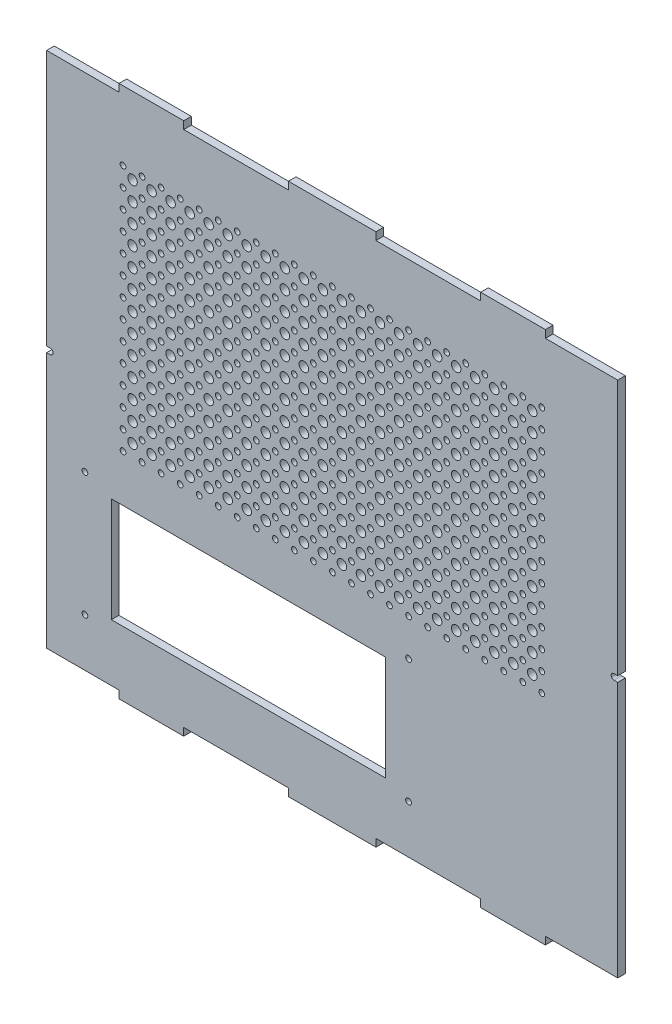
from build123d import *

# Parameters (mm, degrees)
SKETCH1_R           = 1.5
SKETCH1_W           = 144
SKETCH1_H           = 55
SKETCH1_R_2         = 2.5
BOSS_EXTRUDE1_DEPTH = 4


with BuildPart() as part:
    # Sketch1 → Boss-Extrude1 (new body)
    with BuildSketch(Plane.XY):
        with BuildLine():
            Line((-78, 140), (-112, 140))
            Line((-112, 140), (-112, 136))
            Line((-112, 136), (-150, 136))
            Line((-150, 136), (-150, 1.5))
            Line((-150, 1.5), (-148.049455327, 1.5))
            ThreePointArc((-148.049455327, 1.5), (-146.549455327, 0), (-148.049455327, -1.5))
            Line((-148.049455327, -1.5), (-150, -1.5))
            Line((-150, -1.5), (-150, -136))
            Line((-150, -136), (-112, -136))
            Line((-112, -136), (-112, -140))
            Line((-112, -140), (-78, -140))
            Line((-78, -140), (-78, -136))
            Line((-78, -136), (-23, -136))
            Line((-23, -136), (-23, -140))
            Line((-23, -140), (23, -140))
            Line((23, -140), (23, -136))
            Line((23, -136), (78, -136))
            Line((78, -136), (78, -140))
            Line((78, -140), (112, -140))
            Line((112, -140), (112, -136))
            Line((112, -136), (150, -136))
            Line((150, -136), (150, -1.5))
            Line((150, -1.5), (148.049455327, -1.5))
            ThreePointArc((148.049455327, -1.5), (146.549455327, 0), (148.049455327, 1.5))
            Line((148.049455327, 1.5), (150, 1.5))
            Line((150, 1.5), (150, 136))
            Line((150, 136), (112, 136))
            Line((112, 136), (112, 140))
            Line((112, 140), (78, 140))
            Line((78, 140), (78, 136))
            Line((78, 136), (23, 136))
            Line((23, 136), (23, 140))
            Line((23, 140), (-23, 140))
            Line((-23, 140), (-23, 136))
            Line((-23, 136), (-78, 136))
            Line((-78, 136), (-78, 140))
        make_face()
        with Locations((110.112263803, 103.682279134)):
            Circle(SKETCH1_R, mode=Mode.SUBTRACT)
        with Locations((-129.889105123, -110.626211869)):
            Circle(SKETCH1_R, mode=Mode.SUBTRACT)
        with Locations((-44, -78.5)):
            Rectangle(SKETCH1_W, SKETCH1_H, mode=Mode.SUBTRACT)
        with Locations((-129.889105123, -45.69513346)):
            Circle(SKETCH1_R, mode=Mode.SUBTRACT)
        with Locations((-109.887736197, -26.317720866)):
            Circle(SKETCH1_R, mode=Mode.SUBTRACT)
        with Locations((-99.887736197, -26.317720866)):
            Circle(SKETCH1_R, mode=Mode.SUBTRACT)
        with Locations((-104.887736197, -20.317720866)):
            Circle(SKETCH1_R_2, mode=Mode.SUBTRACT)
        with Locations((-94.887736197, -20.317720866)):
            Circle(SKETCH1_R_2, mode=Mode.SUBTRACT)
        with Locations((-89.887736197, -26.317720866)):
            Circle(SKETCH1_R, mode=Mode.SUBTRACT)
        with Locations((-79.887736197, -26.317720866)):
            Circle(SKETCH1_R, mode=Mode.SUBTRACT)
        with Locations((-84.887736197, -20.317720866)):
            Circle(SKETCH1_R_2, mode=Mode.SUBTRACT)
        with Locations((-109.887736197, -16.317720866)):
            Circle(SKETCH1_R, mode=Mode.SUBTRACT)
        with Locations((-104.887736197, -10.317720866)):
            Circle(SKETCH1_R_2, mode=Mode.SUBTRACT)
        with Locations((-99.887736197, -16.317720866)):
            Circle(SKETCH1_R, mode=Mode.SUBTRACT)
        with Locations((-94.887736197, -10.317720866)):
            Circle(SKETCH1_R_2, mode=Mode.SUBTRACT)
        with Locations((-109.887736197, -6.317720866)):
            Circle(SKETCH1_R, mode=Mode.SUBTRACT)
        with Locations((-104.887736197, -0.317720866)):
            Circle(SKETCH1_R_2, mode=Mode.SUBTRACT)
        with Locations((-99.887736197, -6.317720866)):
            Circle(SKETCH1_R, mode=Mode.SUBTRACT)
        with Locations((-94.887736197, -0.317720866)):
            Circle(SKETCH1_R_2, mode=Mode.SUBTRACT)
        with Locations((-89.887736197, -16.317720866)):
            Circle(SKETCH1_R, mode=Mode.SUBTRACT)
        with Locations((-84.887736197, -10.317720866)):
            Circle(SKETCH1_R_2, mode=Mode.SUBTRACT)
        with Locations((-79.887736197, -16.317720866)):
            Circle(SKETCH1_R, mode=Mode.SUBTRACT)
        with Locations((-89.887736197, -6.317720866)):
            Circle(SKETCH1_R, mode=Mode.SUBTRACT)
        with Locations((-84.887736197, -0.317720866)):
            Circle(SKETCH1_R_2, mode=Mode.SUBTRACT)
        with Locations((-79.887736197, -6.317720866)):
            Circle(SKETCH1_R, mode=Mode.SUBTRACT)
        with Locations((-69.887736197, -26.317720866)):
            Circle(SKETCH1_R, mode=Mode.SUBTRACT)
        with Locations((-59.887736197, -26.317720866)):
            Circle(SKETCH1_R, mode=Mode.SUBTRACT)
        with Locations((-74.887736197, -20.317720866)):
            Circle(SKETCH1_R_2, mode=Mode.SUBTRACT)
        with Locations((-64.887736197, -20.317720866)):
            Circle(SKETCH1_R_2, mode=Mode.SUBTRACT)
        with Locations((-49.887736197, -26.317720866)):
            Circle(SKETCH1_R, mode=Mode.SUBTRACT)
        with Locations((-39.887736197, -26.317720866)):
            Circle(SKETCH1_R, mode=Mode.SUBTRACT)
        with Locations((-54.887736197, -20.317720866)):
            Circle(SKETCH1_R_2, mode=Mode.SUBTRACT)
        with Locations((-44.887736197, -20.317720866)):
            Circle(SKETCH1_R_2, mode=Mode.SUBTRACT)
        with Locations((-69.887736197, -16.317720866)):
            Circle(SKETCH1_R, mode=Mode.SUBTRACT)
        with Locations((-74.887736197, -10.317720866)):
            Circle(SKETCH1_R_2, mode=Mode.SUBTRACT)
        with Locations((-59.887736197, -16.317720866)):
            Circle(SKETCH1_R, mode=Mode.SUBTRACT)
        with Locations((-64.887736197, -10.317720866)):
            Circle(SKETCH1_R_2, mode=Mode.SUBTRACT)
        with Locations((-69.887736197, -6.317720866)):
            Circle(SKETCH1_R, mode=Mode.SUBTRACT)
        with Locations((-74.887736197, -0.317720866)):
            Circle(SKETCH1_R_2, mode=Mode.SUBTRACT)
        with Locations((-59.887736197, -6.317720866)):
            Circle(SKETCH1_R, mode=Mode.SUBTRACT)
        with Locations((-64.887736197, -0.317720866)):
            Circle(SKETCH1_R_2, mode=Mode.SUBTRACT)
        with Locations((-49.887736197, -16.317720866)):
            Circle(SKETCH1_R, mode=Mode.SUBTRACT)
        with Locations((-54.887736197, -10.317720866)):
            Circle(SKETCH1_R_2, mode=Mode.SUBTRACT)
        with Locations((-39.887736197, -16.317720866)):
            Circle(SKETCH1_R, mode=Mode.SUBTRACT)
        with Locations((-44.887736197, -10.317720866)):
            Circle(SKETCH1_R_2, mode=Mode.SUBTRACT)
        with Locations((-49.887736197, -6.317720866)):
            Circle(SKETCH1_R, mode=Mode.SUBTRACT)
        with Locations((-54.887736197, -0.317720866)):
            Circle(SKETCH1_R_2, mode=Mode.SUBTRACT)
        with Locations((-39.887736197, -6.317720866)):
            Circle(SKETCH1_R, mode=Mode.SUBTRACT)
        with Locations((-44.887736197, -0.317720866)):
            Circle(SKETCH1_R_2, mode=Mode.SUBTRACT)
        with Locations((-29.887736197, -26.317720866)):
            Circle(SKETCH1_R, mode=Mode.SUBTRACT)
        with Locations((-19.887736197, -26.317720866)):
            Circle(SKETCH1_R, mode=Mode.SUBTRACT)
        with Locations((-34.887736197, -20.317720866)):
            Circle(SKETCH1_R_2, mode=Mode.SUBTRACT)
        with Locations((-24.887736197, -20.317720866)):
            Circle(SKETCH1_R_2, mode=Mode.SUBTRACT)
        with Locations((-9.887736197, -26.317720866)):
            Circle(SKETCH1_R, mode=Mode.SUBTRACT)
        with Locations((-14.887736197, -20.317720866)):
            Circle(SKETCH1_R_2, mode=Mode.SUBTRACT)
        with Locations((-4.887736197, -20.317720866)):
            Circle(SKETCH1_R_2, mode=Mode.SUBTRACT)
        with Locations((-29.887736197, -16.317720866)):
            Circle(SKETCH1_R, mode=Mode.SUBTRACT)
        with Locations((-34.887736197, -10.317720866)):
            Circle(SKETCH1_R_2, mode=Mode.SUBTRACT)
        with Locations((-19.887736197, -16.317720866)):
            Circle(SKETCH1_R, mode=Mode.SUBTRACT)
        with Locations((-24.887736197, -10.317720866)):
            Circle(SKETCH1_R_2, mode=Mode.SUBTRACT)
        with Locations((-29.887736197, -6.317720866)):
            Circle(SKETCH1_R, mode=Mode.SUBTRACT)
        with Locations((-34.887736197, -0.317720866)):
            Circle(SKETCH1_R_2, mode=Mode.SUBTRACT)
        with Locations((-19.887736197, -6.317720866)):
            Circle(SKETCH1_R, mode=Mode.SUBTRACT)
        with Locations((-24.887736197, -0.317720866)):
            Circle(SKETCH1_R_2, mode=Mode.SUBTRACT)
        with Locations((-9.887736197, -16.317720866)):
            Circle(SKETCH1_R, mode=Mode.SUBTRACT)
        with Locations((-14.887736197, -10.317720866)):
            Circle(SKETCH1_R_2, mode=Mode.SUBTRACT)
        with Locations((-4.887736197, -10.317720866)):
            Circle(SKETCH1_R_2, mode=Mode.SUBTRACT)
        with Locations((-9.887736197, -6.317720866)):
            Circle(SKETCH1_R, mode=Mode.SUBTRACT)
        with Locations((-14.887736197, -0.317720866)):
            Circle(SKETCH1_R_2, mode=Mode.SUBTRACT)
        with Locations((-4.887736197, -0.317720866)):
            Circle(SKETCH1_R_2, mode=Mode.SUBTRACT)
        with Locations((40.112263803, -110.626211869)):
            Circle(SKETCH1_R, mode=Mode.SUBTRACT)
        with Locations((40.112263803, -45.69513346)):
            Circle(SKETCH1_R, mode=Mode.SUBTRACT)
        with Locations((0.112263803, -26.317720866)):
            Circle(SKETCH1_R, mode=Mode.SUBTRACT)
        with Locations((10.112263803, -26.317720866)):
            Circle(SKETCH1_R, mode=Mode.SUBTRACT)
        with Locations((5.112263803, -20.317720866)):
            Circle(SKETCH1_R_2, mode=Mode.SUBTRACT)
        with Locations((15.112263803, -20.317720866)):
            Circle(SKETCH1_R_2, mode=Mode.SUBTRACT)
        with Locations((20.112263803, -26.317720866)):
            Circle(SKETCH1_R, mode=Mode.SUBTRACT)
        with Locations((30.112263803, -26.317720866)):
            Circle(SKETCH1_R, mode=Mode.SUBTRACT)
        with Locations((25.112263803, -20.317720866)):
            Circle(SKETCH1_R_2, mode=Mode.SUBTRACT)
        with Locations((35.112263803, -20.317720866)):
            Circle(SKETCH1_R_2, mode=Mode.SUBTRACT)
        with Locations((0.112263803, -16.317720866)):
            Circle(SKETCH1_R, mode=Mode.SUBTRACT)
        with Locations((5.112263803, -10.317720866)):
            Circle(SKETCH1_R_2, mode=Mode.SUBTRACT)
        with Locations((10.112263803, -16.317720866)):
            Circle(SKETCH1_R, mode=Mode.SUBTRACT)
        with Locations((15.112263803, -10.317720866)):
            Circle(SKETCH1_R_2, mode=Mode.SUBTRACT)
        with Locations((0.112263803, -6.317720866)):
            Circle(SKETCH1_R, mode=Mode.SUBTRACT)
        with Locations((5.112263803, -0.317720866)):
            Circle(SKETCH1_R_2, mode=Mode.SUBTRACT)
        with Locations((10.112263803, -6.317720866)):
            Circle(SKETCH1_R, mode=Mode.SUBTRACT)
        with Locations((15.112263803, -0.317720866)):
            Circle(SKETCH1_R_2, mode=Mode.SUBTRACT)
        with Locations((20.112263803, -16.317720866)):
            Circle(SKETCH1_R, mode=Mode.SUBTRACT)
        with Locations((25.112263803, -10.317720866)):
            Circle(SKETCH1_R_2, mode=Mode.SUBTRACT)
        with Locations((30.112263803, -16.317720866)):
            Circle(SKETCH1_R, mode=Mode.SUBTRACT)
        with Locations((35.112263803, -10.317720866)):
            Circle(SKETCH1_R_2, mode=Mode.SUBTRACT)
        with Locations((20.112263803, -6.317720866)):
            Circle(SKETCH1_R, mode=Mode.SUBTRACT)
        with Locations((25.112263803, -0.317720866)):
            Circle(SKETCH1_R_2, mode=Mode.SUBTRACT)
        with Locations((30.112263803, -6.317720866)):
            Circle(SKETCH1_R, mode=Mode.SUBTRACT)
        with Locations((35.112263803, -0.317720866)):
            Circle(SKETCH1_R_2, mode=Mode.SUBTRACT)
        with Locations((40.112263803, -26.317720866)):
            Circle(SKETCH1_R, mode=Mode.SUBTRACT)
        with Locations((50.112263803, -26.317720866)):
            Circle(SKETCH1_R, mode=Mode.SUBTRACT)
        with Locations((45.112263803, -20.317720866)):
            Circle(SKETCH1_R_2, mode=Mode.SUBTRACT)
        with Locations((55.112263803, -20.317720866)):
            Circle(SKETCH1_R_2, mode=Mode.SUBTRACT)
        with Locations((60.112263803, -26.317720866)):
            Circle(SKETCH1_R, mode=Mode.SUBTRACT)
        with Locations((70.112263803, -26.317720866)):
            Circle(SKETCH1_R, mode=Mode.SUBTRACT)
        with Locations((65.112263803, -20.317720866)):
            Circle(SKETCH1_R_2, mode=Mode.SUBTRACT)
        with Locations((40.112263803, -16.317720866)):
            Circle(SKETCH1_R, mode=Mode.SUBTRACT)
        with Locations((45.112263803, -10.317720866)):
            Circle(SKETCH1_R_2, mode=Mode.SUBTRACT)
        with Locations((50.112263803, -16.317720866)):
            Circle(SKETCH1_R, mode=Mode.SUBTRACT)
        with Locations((55.112263803, -10.317720866)):
            Circle(SKETCH1_R_2, mode=Mode.SUBTRACT)
        with Locations((40.112263803, -6.317720866)):
            Circle(SKETCH1_R, mode=Mode.SUBTRACT)
        with Locations((45.112263803, -0.317720866)):
            Circle(SKETCH1_R_2, mode=Mode.SUBTRACT)
        with Locations((50.112263803, -6.317720866)):
            Circle(SKETCH1_R, mode=Mode.SUBTRACT)
        with Locations((55.112263803, -0.317720866)):
            Circle(SKETCH1_R_2, mode=Mode.SUBTRACT)
        with Locations((60.112263803, -16.317720866)):
            Circle(SKETCH1_R, mode=Mode.SUBTRACT)
        with Locations((65.112263803, -10.317720866)):
            Circle(SKETCH1_R_2, mode=Mode.SUBTRACT)
        with Locations((70.112263803, -16.317720866)):
            Circle(SKETCH1_R, mode=Mode.SUBTRACT)
        with Locations((60.112263803, -6.317720866)):
            Circle(SKETCH1_R, mode=Mode.SUBTRACT)
        with Locations((65.112263803, -0.317720866)):
            Circle(SKETCH1_R_2, mode=Mode.SUBTRACT)
        with Locations((70.112263803, -6.317720866)):
            Circle(SKETCH1_R, mode=Mode.SUBTRACT)
        with Locations((80.112263803, -26.317720866)):
            Circle(SKETCH1_R, mode=Mode.SUBTRACT)
        with Locations((90.112263803, -26.317720866)):
            Circle(SKETCH1_R, mode=Mode.SUBTRACT)
        with Locations((75.112263803, -20.317720866)):
            Circle(SKETCH1_R_2, mode=Mode.SUBTRACT)
        with Locations((85.112263803, -20.317720866)):
            Circle(SKETCH1_R_2, mode=Mode.SUBTRACT)
        with Locations((100.112263803, -26.317720866)):
            Circle(SKETCH1_R, mode=Mode.SUBTRACT)
        with Locations((110.112263803, -26.317720866)):
            Circle(SKETCH1_R, mode=Mode.SUBTRACT)
        with Locations((95.112263803, -20.317720866)):
            Circle(SKETCH1_R_2, mode=Mode.SUBTRACT)
        with Locations((105.112263803, -20.317720866)):
            Circle(SKETCH1_R_2, mode=Mode.SUBTRACT)
        with Locations((80.112263803, -16.317720866)):
            Circle(SKETCH1_R, mode=Mode.SUBTRACT)
        with Locations((75.112263803, -10.317720866)):
            Circle(SKETCH1_R_2, mode=Mode.SUBTRACT)
        with Locations((90.112263803, -16.317720866)):
            Circle(SKETCH1_R, mode=Mode.SUBTRACT)
        with Locations((85.112263803, -10.317720866)):
            Circle(SKETCH1_R_2, mode=Mode.SUBTRACT)
        with Locations((80.112263803, -6.317720866)):
            Circle(SKETCH1_R, mode=Mode.SUBTRACT)
        with Locations((75.112263803, -0.317720866)):
            Circle(SKETCH1_R_2, mode=Mode.SUBTRACT)
        with Locations((90.112263803, -6.317720866)):
            Circle(SKETCH1_R, mode=Mode.SUBTRACT)
        with Locations((85.112263803, -0.317720866)):
            Circle(SKETCH1_R_2, mode=Mode.SUBTRACT)
        with Locations((100.112263803, -16.317720866)):
            Circle(SKETCH1_R, mode=Mode.SUBTRACT)
        with Locations((95.112263803, -10.317720866)):
            Circle(SKETCH1_R_2, mode=Mode.SUBTRACT)
        with Locations((110.112263803, -16.317720866)):
            Circle(SKETCH1_R, mode=Mode.SUBTRACT)
        with Locations((105.112263803, -10.317720866)):
            Circle(SKETCH1_R_2, mode=Mode.SUBTRACT)
        with Locations((100.112263803, -6.317720866)):
            Circle(SKETCH1_R, mode=Mode.SUBTRACT)
        with Locations((95.112263803, -0.317720866)):
            Circle(SKETCH1_R_2, mode=Mode.SUBTRACT)
        with Locations((110.112263803, -6.317720866)):
            Circle(SKETCH1_R, mode=Mode.SUBTRACT)
        with Locations((105.112263803, -0.317720866)):
            Circle(SKETCH1_R_2, mode=Mode.SUBTRACT)
        with Locations((-109.887736197, 3.682279134)):
            Circle(SKETCH1_R, mode=Mode.SUBTRACT)
        with Locations((-99.887736197, 3.682279134)):
            Circle(SKETCH1_R, mode=Mode.SUBTRACT)
        with Locations((-104.887736197, 9.682279134)):
            Circle(SKETCH1_R_2, mode=Mode.SUBTRACT)
        with Locations((-109.887736197, 13.682279134)):
            Circle(SKETCH1_R, mode=Mode.SUBTRACT)
        with Locations((-94.887736197, 9.682279134)):
            Circle(SKETCH1_R_2, mode=Mode.SUBTRACT)
        with Locations((-99.887736197, 13.682279134)):
            Circle(SKETCH1_R, mode=Mode.SUBTRACT)
        with Locations((-89.887736197, 3.682279134)):
            Circle(SKETCH1_R, mode=Mode.SUBTRACT)
        with Locations((-79.887736197, 3.682279134)):
            Circle(SKETCH1_R, mode=Mode.SUBTRACT)
        with Locations((-84.887736197, 9.682279134)):
            Circle(SKETCH1_R_2, mode=Mode.SUBTRACT)
        with Locations((-89.887736197, 13.682279134)):
            Circle(SKETCH1_R, mode=Mode.SUBTRACT)
        with Locations((-79.887736197, 13.682279134)):
            Circle(SKETCH1_R, mode=Mode.SUBTRACT)
        with Locations((-104.887736197, 19.682279134)):
            Circle(SKETCH1_R_2, mode=Mode.SUBTRACT)
        with Locations((-109.887736197, 23.682279134)):
            Circle(SKETCH1_R, mode=Mode.SUBTRACT)
        with Locations((-94.887736197, 19.682279134)):
            Circle(SKETCH1_R_2, mode=Mode.SUBTRACT)
        with Locations((-99.887736197, 23.682279134)):
            Circle(SKETCH1_R, mode=Mode.SUBTRACT)
        with Locations((-104.887736197, 29.682279134)):
            Circle(SKETCH1_R_2, mode=Mode.SUBTRACT)
        with Locations((-109.887736197, 33.682279134)):
            Circle(SKETCH1_R, mode=Mode.SUBTRACT)
        with Locations((-94.887736197, 29.682279134)):
            Circle(SKETCH1_R_2, mode=Mode.SUBTRACT)
        with Locations((-99.887736197, 33.682279134)):
            Circle(SKETCH1_R, mode=Mode.SUBTRACT)
        with Locations((-84.887736197, 19.682279134)):
            Circle(SKETCH1_R_2, mode=Mode.SUBTRACT)
        with Locations((-89.887736197, 23.682279134)):
            Circle(SKETCH1_R, mode=Mode.SUBTRACT)
        with Locations((-79.887736197, 23.682279134)):
            Circle(SKETCH1_R, mode=Mode.SUBTRACT)
        with Locations((-84.887736197, 29.682279134)):
            Circle(SKETCH1_R_2, mode=Mode.SUBTRACT)
        with Locations((-89.887736197, 33.682279134)):
            Circle(SKETCH1_R, mode=Mode.SUBTRACT)
        with Locations((-79.887736197, 33.682279134)):
            Circle(SKETCH1_R, mode=Mode.SUBTRACT)
        with Locations((-109.887736197, 43.682279134)):
            Circle(SKETCH1_R, mode=Mode.SUBTRACT)
        with Locations((-104.887736197, 39.682279134)):
            Circle(SKETCH1_R_2, mode=Mode.SUBTRACT)
        with Locations((-99.887736197, 43.682279134)):
            Circle(SKETCH1_R, mode=Mode.SUBTRACT)
        with Locations((-94.887736197, 39.682279134)):
            Circle(SKETCH1_R_2, mode=Mode.SUBTRACT)
        with Locations((-104.887736197, 49.682279134)):
            Circle(SKETCH1_R_2, mode=Mode.SUBTRACT)
        with Locations((-94.887736197, 49.682279134)):
            Circle(SKETCH1_R_2, mode=Mode.SUBTRACT)
        with Locations((-89.887736197, 43.682279134)):
            Circle(SKETCH1_R, mode=Mode.SUBTRACT)
        with Locations((-84.887736197, 39.682279134)):
            Circle(SKETCH1_R_2, mode=Mode.SUBTRACT)
        with Locations((-79.887736197, 43.682279134)):
            Circle(SKETCH1_R, mode=Mode.SUBTRACT)
        with Locations((-84.887736197, 49.682279134)):
            Circle(SKETCH1_R_2, mode=Mode.SUBTRACT)
        with Locations((-109.887736197, 53.682279134)):
            Circle(SKETCH1_R, mode=Mode.SUBTRACT)
        with Locations((-104.887736197, 59.682279134)):
            Circle(SKETCH1_R_2, mode=Mode.SUBTRACT)
        with Locations((-99.887736197, 53.682279134)):
            Circle(SKETCH1_R, mode=Mode.SUBTRACT)
        with Locations((-94.887736197, 59.682279134)):
            Circle(SKETCH1_R_2, mode=Mode.SUBTRACT)
        with Locations((-109.887736197, 63.682279134)):
            Circle(SKETCH1_R, mode=Mode.SUBTRACT)
        with Locations((-104.887736197, 69.682279134)):
            Circle(SKETCH1_R_2, mode=Mode.SUBTRACT)
        with Locations((-99.887736197, 63.682279134)):
            Circle(SKETCH1_R, mode=Mode.SUBTRACT)
        with Locations((-94.887736197, 69.682279134)):
            Circle(SKETCH1_R_2, mode=Mode.SUBTRACT)
        with Locations((-89.887736197, 53.682279134)):
            Circle(SKETCH1_R, mode=Mode.SUBTRACT)
        with Locations((-84.887736197, 59.682279134)):
            Circle(SKETCH1_R_2, mode=Mode.SUBTRACT)
        with Locations((-79.887736197, 53.682279134)):
            Circle(SKETCH1_R, mode=Mode.SUBTRACT)
        with Locations((-89.887736197, 63.682279134)):
            Circle(SKETCH1_R, mode=Mode.SUBTRACT)
        with Locations((-84.887736197, 69.682279134)):
            Circle(SKETCH1_R_2, mode=Mode.SUBTRACT)
        with Locations((-79.887736197, 63.682279134)):
            Circle(SKETCH1_R, mode=Mode.SUBTRACT)
        with Locations((-69.887736197, 3.682279134)):
            Circle(SKETCH1_R, mode=Mode.SUBTRACT)
        with Locations((-59.887736197, 3.682279134)):
            Circle(SKETCH1_R, mode=Mode.SUBTRACT)
        with Locations((-74.887736197, 9.682279134)):
            Circle(SKETCH1_R_2, mode=Mode.SUBTRACT)
        with Locations((-69.887736197, 13.682279134)):
            Circle(SKETCH1_R, mode=Mode.SUBTRACT)
        with Locations((-64.887736197, 9.682279134)):
            Circle(SKETCH1_R_2, mode=Mode.SUBTRACT)
        with Locations((-59.887736197, 13.682279134)):
            Circle(SKETCH1_R, mode=Mode.SUBTRACT)
        with Locations((-49.887736197, 3.682279134)):
            Circle(SKETCH1_R, mode=Mode.SUBTRACT)
        with Locations((-39.887736197, 3.682279134)):
            Circle(SKETCH1_R, mode=Mode.SUBTRACT)
        with Locations((-54.887736197, 9.682279134)):
            Circle(SKETCH1_R_2, mode=Mode.SUBTRACT)
        with Locations((-49.887736197, 13.682279134)):
            Circle(SKETCH1_R, mode=Mode.SUBTRACT)
        with Locations((-44.887736197, 9.682279134)):
            Circle(SKETCH1_R_2, mode=Mode.SUBTRACT)
        with Locations((-39.887736197, 13.682279134)):
            Circle(SKETCH1_R, mode=Mode.SUBTRACT)
        with Locations((-74.887736197, 19.682279134)):
            Circle(SKETCH1_R_2, mode=Mode.SUBTRACT)
        with Locations((-69.887736197, 23.682279134)):
            Circle(SKETCH1_R, mode=Mode.SUBTRACT)
        with Locations((-64.887736197, 19.682279134)):
            Circle(SKETCH1_R_2, mode=Mode.SUBTRACT)
        with Locations((-59.887736197, 23.682279134)):
            Circle(SKETCH1_R, mode=Mode.SUBTRACT)
        with Locations((-74.887736197, 29.682279134)):
            Circle(SKETCH1_R_2, mode=Mode.SUBTRACT)
        with Locations((-69.887736197, 33.682279134)):
            Circle(SKETCH1_R, mode=Mode.SUBTRACT)
        with Locations((-64.887736197, 29.682279134)):
            Circle(SKETCH1_R_2, mode=Mode.SUBTRACT)
        with Locations((-59.887736197, 33.682279134)):
            Circle(SKETCH1_R, mode=Mode.SUBTRACT)
        with Locations((-54.887736197, 19.682279134)):
            Circle(SKETCH1_R_2, mode=Mode.SUBTRACT)
        with Locations((-49.887736197, 23.682279134)):
            Circle(SKETCH1_R, mode=Mode.SUBTRACT)
        with Locations((-44.887736197, 19.682279134)):
            Circle(SKETCH1_R_2, mode=Mode.SUBTRACT)
        with Locations((-39.887736197, 23.682279134)):
            Circle(SKETCH1_R, mode=Mode.SUBTRACT)
        with Locations((-54.887736197, 29.682279134)):
            Circle(SKETCH1_R_2, mode=Mode.SUBTRACT)
        with Locations((-49.887736197, 33.682279134)):
            Circle(SKETCH1_R, mode=Mode.SUBTRACT)
        with Locations((-44.887736197, 29.682279134)):
            Circle(SKETCH1_R_2, mode=Mode.SUBTRACT)
        with Locations((-39.887736197, 33.682279134)):
            Circle(SKETCH1_R, mode=Mode.SUBTRACT)
        with Locations((-29.887736197, 3.682279134)):
            Circle(SKETCH1_R, mode=Mode.SUBTRACT)
        with Locations((-19.887736197, 3.682279134)):
            Circle(SKETCH1_R, mode=Mode.SUBTRACT)
        with Locations((-34.887736197, 9.682279134)):
            Circle(SKETCH1_R_2, mode=Mode.SUBTRACT)
        with Locations((-29.887736197, 13.682279134)):
            Circle(SKETCH1_R, mode=Mode.SUBTRACT)
        with Locations((-24.887736197, 9.682279134)):
            Circle(SKETCH1_R_2, mode=Mode.SUBTRACT)
        with Locations((-19.887736197, 13.682279134)):
            Circle(SKETCH1_R, mode=Mode.SUBTRACT)
        with Locations((-9.887736197, 3.682279134)):
            Circle(SKETCH1_R, mode=Mode.SUBTRACT)
        with Locations((-14.887736197, 9.682279134)):
            Circle(SKETCH1_R_2, mode=Mode.SUBTRACT)
        with Locations((-9.887736197, 13.682279134)):
            Circle(SKETCH1_R, mode=Mode.SUBTRACT)
        with Locations((-4.887736197, 9.682279134)):
            Circle(SKETCH1_R_2, mode=Mode.SUBTRACT)
        with Locations((-34.887736197, 19.682279134)):
            Circle(SKETCH1_R_2, mode=Mode.SUBTRACT)
        with Locations((-29.887736197, 23.682279134)):
            Circle(SKETCH1_R, mode=Mode.SUBTRACT)
        with Locations((-24.887736197, 19.682279134)):
            Circle(SKETCH1_R_2, mode=Mode.SUBTRACT)
        with Locations((-19.887736197, 23.682279134)):
            Circle(SKETCH1_R, mode=Mode.SUBTRACT)
        with Locations((-34.887736197, 29.682279134)):
            Circle(SKETCH1_R_2, mode=Mode.SUBTRACT)
        with Locations((-29.887736197, 33.682279134)):
            Circle(SKETCH1_R, mode=Mode.SUBTRACT)
        with Locations((-24.887736197, 29.682279134)):
            Circle(SKETCH1_R_2, mode=Mode.SUBTRACT)
        with Locations((-19.887736197, 33.682279134)):
            Circle(SKETCH1_R, mode=Mode.SUBTRACT)
        with Locations((-14.887736197, 19.682279134)):
            Circle(SKETCH1_R_2, mode=Mode.SUBTRACT)
        with Locations((-9.887736197, 23.682279134)):
            Circle(SKETCH1_R, mode=Mode.SUBTRACT)
        with Locations((-4.887736197, 19.682279134)):
            Circle(SKETCH1_R_2, mode=Mode.SUBTRACT)
        with Locations((-14.887736197, 29.682279134)):
            Circle(SKETCH1_R_2, mode=Mode.SUBTRACT)
        with Locations((-9.887736197, 33.682279134)):
            Circle(SKETCH1_R, mode=Mode.SUBTRACT)
        with Locations((-4.887736197, 29.682279134)):
            Circle(SKETCH1_R_2, mode=Mode.SUBTRACT)
        with Locations((-74.887736197, 39.682279134)):
            Circle(SKETCH1_R_2, mode=Mode.SUBTRACT)
        with Locations((-69.887736197, 43.682279134)):
            Circle(SKETCH1_R, mode=Mode.SUBTRACT)
        with Locations((-64.887736197, 39.682279134)):
            Circle(SKETCH1_R_2, mode=Mode.SUBTRACT)
        with Locations((-59.887736197, 43.682279134)):
            Circle(SKETCH1_R, mode=Mode.SUBTRACT)
        with Locations((-74.887736197, 49.682279134)):
            Circle(SKETCH1_R_2, mode=Mode.SUBTRACT)
        with Locations((-64.887736197, 49.682279134)):
            Circle(SKETCH1_R_2, mode=Mode.SUBTRACT)
        with Locations((-54.887736197, 39.682279134)):
            Circle(SKETCH1_R_2, mode=Mode.SUBTRACT)
        with Locations((-49.887736197, 43.682279134)):
            Circle(SKETCH1_R, mode=Mode.SUBTRACT)
        with Locations((-44.887736197, 39.682279134)):
            Circle(SKETCH1_R_2, mode=Mode.SUBTRACT)
        with Locations((-39.887736197, 43.682279134)):
            Circle(SKETCH1_R, mode=Mode.SUBTRACT)
        with Locations((-54.887736197, 49.682279134)):
            Circle(SKETCH1_R_2, mode=Mode.SUBTRACT)
        with Locations((-44.887736197, 49.682279134)):
            Circle(SKETCH1_R_2, mode=Mode.SUBTRACT)
        with Locations((-69.887736197, 53.682279134)):
            Circle(SKETCH1_R, mode=Mode.SUBTRACT)
        with Locations((-74.887736197, 59.682279134)):
            Circle(SKETCH1_R_2, mode=Mode.SUBTRACT)
        with Locations((-59.887736197, 53.682279134)):
            Circle(SKETCH1_R, mode=Mode.SUBTRACT)
        with Locations((-64.887736197, 59.682279134)):
            Circle(SKETCH1_R_2, mode=Mode.SUBTRACT)
        with Locations((-69.887736197, 63.682279134)):
            Circle(SKETCH1_R, mode=Mode.SUBTRACT)
        with Locations((-74.887736197, 69.682279134)):
            Circle(SKETCH1_R_2, mode=Mode.SUBTRACT)
        with Locations((-59.887736197, 63.682279134)):
            Circle(SKETCH1_R, mode=Mode.SUBTRACT)
        with Locations((-64.887736197, 69.682279134)):
            Circle(SKETCH1_R_2, mode=Mode.SUBTRACT)
        with Locations((-49.887736197, 53.682279134)):
            Circle(SKETCH1_R, mode=Mode.SUBTRACT)
        with Locations((-54.887736197, 59.682279134)):
            Circle(SKETCH1_R_2, mode=Mode.SUBTRACT)
        with Locations((-39.887736197, 53.682279134)):
            Circle(SKETCH1_R, mode=Mode.SUBTRACT)
        with Locations((-44.887736197, 59.682279134)):
            Circle(SKETCH1_R_2, mode=Mode.SUBTRACT)
        with Locations((-49.887736197, 63.682279134)):
            Circle(SKETCH1_R, mode=Mode.SUBTRACT)
        with Locations((-54.887736197, 69.682279134)):
            Circle(SKETCH1_R_2, mode=Mode.SUBTRACT)
        with Locations((-39.887736197, 63.682279134)):
            Circle(SKETCH1_R, mode=Mode.SUBTRACT)
        with Locations((-44.887736197, 69.682279134)):
            Circle(SKETCH1_R_2, mode=Mode.SUBTRACT)
        with Locations((-34.887736197, 39.682279134)):
            Circle(SKETCH1_R_2, mode=Mode.SUBTRACT)
        with Locations((-29.887736197, 43.682279134)):
            Circle(SKETCH1_R, mode=Mode.SUBTRACT)
        with Locations((-24.887736197, 39.682279134)):
            Circle(SKETCH1_R_2, mode=Mode.SUBTRACT)
        with Locations((-19.887736197, 43.682279134)):
            Circle(SKETCH1_R, mode=Mode.SUBTRACT)
        with Locations((-34.887736197, 49.682279134)):
            Circle(SKETCH1_R_2, mode=Mode.SUBTRACT)
        with Locations((-24.887736197, 49.682279134)):
            Circle(SKETCH1_R_2, mode=Mode.SUBTRACT)
        with Locations((-14.887736197, 39.682279134)):
            Circle(SKETCH1_R_2, mode=Mode.SUBTRACT)
        with Locations((-9.887736197, 43.682279134)):
            Circle(SKETCH1_R, mode=Mode.SUBTRACT)
        with Locations((-4.887736197, 39.682279134)):
            Circle(SKETCH1_R_2, mode=Mode.SUBTRACT)
        with Locations((-14.887736197, 49.682279134)):
            Circle(SKETCH1_R_2, mode=Mode.SUBTRACT)
        with Locations((-4.887736197, 49.682279134)):
            Circle(SKETCH1_R_2, mode=Mode.SUBTRACT)
        with Locations((-29.887736197, 53.682279134)):
            Circle(SKETCH1_R, mode=Mode.SUBTRACT)
        with Locations((-34.887736197, 59.682279134)):
            Circle(SKETCH1_R_2, mode=Mode.SUBTRACT)
        with Locations((-19.887736197, 53.682279134)):
            Circle(SKETCH1_R, mode=Mode.SUBTRACT)
        with Locations((-24.887736197, 59.682279134)):
            Circle(SKETCH1_R_2, mode=Mode.SUBTRACT)
        with Locations((-29.887736197, 63.682279134)):
            Circle(SKETCH1_R, mode=Mode.SUBTRACT)
        with Locations((-34.887736197, 69.682279134)):
            Circle(SKETCH1_R_2, mode=Mode.SUBTRACT)
        with Locations((-19.887736197, 63.682279134)):
            Circle(SKETCH1_R, mode=Mode.SUBTRACT)
        with Locations((-24.887736197, 69.682279134)):
            Circle(SKETCH1_R_2, mode=Mode.SUBTRACT)
        with Locations((-9.887736197, 53.682279134)):
            Circle(SKETCH1_R, mode=Mode.SUBTRACT)
        with Locations((-14.887736197, 59.682279134)):
            Circle(SKETCH1_R_2, mode=Mode.SUBTRACT)
        with Locations((-4.887736197, 59.682279134)):
            Circle(SKETCH1_R_2, mode=Mode.SUBTRACT)
        with Locations((-9.887736197, 63.682279134)):
            Circle(SKETCH1_R, mode=Mode.SUBTRACT)
        with Locations((-14.887736197, 69.682279134)):
            Circle(SKETCH1_R_2, mode=Mode.SUBTRACT)
        with Locations((-4.887736197, 69.682279134)):
            Circle(SKETCH1_R_2, mode=Mode.SUBTRACT)
        with Locations((-109.887736197, 73.682279134)):
            Circle(SKETCH1_R, mode=Mode.SUBTRACT)
        with Locations((-99.887736197, 73.682279134)):
            Circle(SKETCH1_R, mode=Mode.SUBTRACT)
        with Locations((-104.887736197, 79.682279134)):
            Circle(SKETCH1_R_2, mode=Mode.SUBTRACT)
        with Locations((-109.887736197, 83.682279134)):
            Circle(SKETCH1_R, mode=Mode.SUBTRACT)
        with Locations((-94.887736197, 79.682279134)):
            Circle(SKETCH1_R_2, mode=Mode.SUBTRACT)
        with Locations((-99.887736197, 83.682279134)):
            Circle(SKETCH1_R, mode=Mode.SUBTRACT)
        with Locations((-89.887736197, 73.682279134)):
            Circle(SKETCH1_R, mode=Mode.SUBTRACT)
        with Locations((-79.887736197, 73.682279134)):
            Circle(SKETCH1_R, mode=Mode.SUBTRACT)
        with Locations((-84.887736197, 79.682279134)):
            Circle(SKETCH1_R_2, mode=Mode.SUBTRACT)
        with Locations((-89.887736197, 83.682279134)):
            Circle(SKETCH1_R, mode=Mode.SUBTRACT)
        with Locations((-79.887736197, 83.682279134)):
            Circle(SKETCH1_R, mode=Mode.SUBTRACT)
        with Locations((-104.887736197, 89.682279134)):
            Circle(SKETCH1_R_2, mode=Mode.SUBTRACT)
        with Locations((-109.887736197, 93.682279134)):
            Circle(SKETCH1_R, mode=Mode.SUBTRACT)
        with Locations((-94.887736197, 89.682279134)):
            Circle(SKETCH1_R_2, mode=Mode.SUBTRACT)
        with Locations((-99.887736197, 93.682279134)):
            Circle(SKETCH1_R, mode=Mode.SUBTRACT)
        with Locations((-104.887736197, 99.682279134)):
            Circle(SKETCH1_R_2, mode=Mode.SUBTRACT)
        with Locations((-109.887736197, 103.682279134)):
            Circle(SKETCH1_R, mode=Mode.SUBTRACT)
        with Locations((-94.887736197, 99.682279134)):
            Circle(SKETCH1_R_2, mode=Mode.SUBTRACT)
        with Locations((-99.887736197, 103.682279134)):
            Circle(SKETCH1_R, mode=Mode.SUBTRACT)
        with Locations((-84.887736197, 89.682279134)):
            Circle(SKETCH1_R_2, mode=Mode.SUBTRACT)
        with Locations((-89.887736197, 93.682279134)):
            Circle(SKETCH1_R, mode=Mode.SUBTRACT)
        with Locations((-79.887736197, 93.682279134)):
            Circle(SKETCH1_R, mode=Mode.SUBTRACT)
        with Locations((-84.887736197, 99.682279134)):
            Circle(SKETCH1_R_2, mode=Mode.SUBTRACT)
        with Locations((-89.887736197, 103.682279134)):
            Circle(SKETCH1_R, mode=Mode.SUBTRACT)
        with Locations((-79.887736197, 103.682279134)):
            Circle(SKETCH1_R, mode=Mode.SUBTRACT)
        with Locations((-69.887736197, 73.682279134)):
            Circle(SKETCH1_R, mode=Mode.SUBTRACT)
        with Locations((-59.887736197, 73.682279134)):
            Circle(SKETCH1_R, mode=Mode.SUBTRACT)
        with Locations((-74.887736197, 79.682279134)):
            Circle(SKETCH1_R_2, mode=Mode.SUBTRACT)
        with Locations((-69.887736197, 83.682279134)):
            Circle(SKETCH1_R, mode=Mode.SUBTRACT)
        with Locations((-64.887736197, 79.682279134)):
            Circle(SKETCH1_R_2, mode=Mode.SUBTRACT)
        with Locations((-59.887736197, 83.682279134)):
            Circle(SKETCH1_R, mode=Mode.SUBTRACT)
        with Locations((-49.887736197, 73.682279134)):
            Circle(SKETCH1_R, mode=Mode.SUBTRACT)
        with Locations((-39.887736197, 73.682279134)):
            Circle(SKETCH1_R, mode=Mode.SUBTRACT)
        with Locations((-54.887736197, 79.682279134)):
            Circle(SKETCH1_R_2, mode=Mode.SUBTRACT)
        with Locations((-49.887736197, 83.682279134)):
            Circle(SKETCH1_R, mode=Mode.SUBTRACT)
        with Locations((-44.887736197, 79.682279134)):
            Circle(SKETCH1_R_2, mode=Mode.SUBTRACT)
        with Locations((-39.887736197, 83.682279134)):
            Circle(SKETCH1_R, mode=Mode.SUBTRACT)
        with Locations((-74.887736197, 89.682279134)):
            Circle(SKETCH1_R_2, mode=Mode.SUBTRACT)
        with Locations((-69.887736197, 93.682279134)):
            Circle(SKETCH1_R, mode=Mode.SUBTRACT)
        with Locations((-64.887736197, 89.682279134)):
            Circle(SKETCH1_R_2, mode=Mode.SUBTRACT)
        with Locations((-59.887736197, 93.682279134)):
            Circle(SKETCH1_R, mode=Mode.SUBTRACT)
        with Locations((-74.887736197, 99.682279134)):
            Circle(SKETCH1_R_2, mode=Mode.SUBTRACT)
        with Locations((-69.887736197, 103.682279134)):
            Circle(SKETCH1_R, mode=Mode.SUBTRACT)
        with Locations((-64.887736197, 99.682279134)):
            Circle(SKETCH1_R_2, mode=Mode.SUBTRACT)
        with Locations((-59.887736197, 103.682279134)):
            Circle(SKETCH1_R, mode=Mode.SUBTRACT)
        with Locations((-54.887736197, 89.682279134)):
            Circle(SKETCH1_R_2, mode=Mode.SUBTRACT)
        with Locations((-49.887736197, 93.682279134)):
            Circle(SKETCH1_R, mode=Mode.SUBTRACT)
        with Locations((-44.887736197, 89.682279134)):
            Circle(SKETCH1_R_2, mode=Mode.SUBTRACT)
        with Locations((-39.887736197, 93.682279134)):
            Circle(SKETCH1_R, mode=Mode.SUBTRACT)
        with Locations((-54.887736197, 99.682279134)):
            Circle(SKETCH1_R_2, mode=Mode.SUBTRACT)
        with Locations((-49.887736197, 103.682279134)):
            Circle(SKETCH1_R, mode=Mode.SUBTRACT)
        with Locations((-44.887736197, 99.682279134)):
            Circle(SKETCH1_R_2, mode=Mode.SUBTRACT)
        with Locations((-39.887736197, 103.682279134)):
            Circle(SKETCH1_R, mode=Mode.SUBTRACT)
        with Locations((-29.887736197, 73.682279134)):
            Circle(SKETCH1_R, mode=Mode.SUBTRACT)
        with Locations((-19.887736197, 73.682279134)):
            Circle(SKETCH1_R, mode=Mode.SUBTRACT)
        with Locations((-34.887736197, 79.682279134)):
            Circle(SKETCH1_R_2, mode=Mode.SUBTRACT)
        with Locations((-29.887736197, 83.682279134)):
            Circle(SKETCH1_R, mode=Mode.SUBTRACT)
        with Locations((-24.887736197, 79.682279134)):
            Circle(SKETCH1_R_2, mode=Mode.SUBTRACT)
        with Locations((-19.887736197, 83.682279134)):
            Circle(SKETCH1_R, mode=Mode.SUBTRACT)
        with Locations((-9.887736197, 73.682279134)):
            Circle(SKETCH1_R, mode=Mode.SUBTRACT)
        with Locations((-14.887736197, 79.682279134)):
            Circle(SKETCH1_R_2, mode=Mode.SUBTRACT)
        with Locations((-9.887736197, 83.682279134)):
            Circle(SKETCH1_R, mode=Mode.SUBTRACT)
        with Locations((-4.887736197, 79.682279134)):
            Circle(SKETCH1_R_2, mode=Mode.SUBTRACT)
        with Locations((-34.887736197, 89.682279134)):
            Circle(SKETCH1_R_2, mode=Mode.SUBTRACT)
        with Locations((-29.887736197, 93.682279134)):
            Circle(SKETCH1_R, mode=Mode.SUBTRACT)
        with Locations((-24.887736197, 89.682279134)):
            Circle(SKETCH1_R_2, mode=Mode.SUBTRACT)
        with Locations((-19.887736197, 93.682279134)):
            Circle(SKETCH1_R, mode=Mode.SUBTRACT)
        with Locations((-34.887736197, 99.682279134)):
            Circle(SKETCH1_R_2, mode=Mode.SUBTRACT)
        with Locations((-29.887736197, 103.682279134)):
            Circle(SKETCH1_R, mode=Mode.SUBTRACT)
        with Locations((-24.887736197, 99.682279134)):
            Circle(SKETCH1_R_2, mode=Mode.SUBTRACT)
        with Locations((-19.887736197, 103.682279134)):
            Circle(SKETCH1_R, mode=Mode.SUBTRACT)
        with Locations((-14.887736197, 89.682279134)):
            Circle(SKETCH1_R_2, mode=Mode.SUBTRACT)
        with Locations((-9.887736197, 93.682279134)):
            Circle(SKETCH1_R, mode=Mode.SUBTRACT)
        with Locations((-4.887736197, 89.682279134)):
            Circle(SKETCH1_R_2, mode=Mode.SUBTRACT)
        with Locations((-14.887736197, 99.682279134)):
            Circle(SKETCH1_R_2, mode=Mode.SUBTRACT)
        with Locations((-9.887736197, 103.682279134)):
            Circle(SKETCH1_R, mode=Mode.SUBTRACT)
        with Locations((-4.887736197, 99.682279134)):
            Circle(SKETCH1_R_2, mode=Mode.SUBTRACT)
        with Locations((0.112263803, 3.682279134)):
            Circle(SKETCH1_R, mode=Mode.SUBTRACT)
        with Locations((10.112263803, 3.682279134)):
            Circle(SKETCH1_R, mode=Mode.SUBTRACT)
        with Locations((5.112263803, 9.682279134)):
            Circle(SKETCH1_R_2, mode=Mode.SUBTRACT)
        with Locations((0.112263803, 13.682279134)):
            Circle(SKETCH1_R, mode=Mode.SUBTRACT)
        with Locations((15.112263803, 9.682279134)):
            Circle(SKETCH1_R_2, mode=Mode.SUBTRACT)
        with Locations((10.112263803, 13.682279134)):
            Circle(SKETCH1_R, mode=Mode.SUBTRACT)
        with Locations((20.112263803, 3.682279134)):
            Circle(SKETCH1_R, mode=Mode.SUBTRACT)
        with Locations((30.112263803, 3.682279134)):
            Circle(SKETCH1_R, mode=Mode.SUBTRACT)
        with Locations((25.112263803, 9.682279134)):
            Circle(SKETCH1_R_2, mode=Mode.SUBTRACT)
        with Locations((20.112263803, 13.682279134)):
            Circle(SKETCH1_R, mode=Mode.SUBTRACT)
        with Locations((35.112263803, 9.682279134)):
            Circle(SKETCH1_R_2, mode=Mode.SUBTRACT)
        with Locations((30.112263803, 13.682279134)):
            Circle(SKETCH1_R, mode=Mode.SUBTRACT)
        with Locations((5.112263803, 19.682279134)):
            Circle(SKETCH1_R_2, mode=Mode.SUBTRACT)
        with Locations((0.112263803, 23.682279134)):
            Circle(SKETCH1_R, mode=Mode.SUBTRACT)
        with Locations((15.112263803, 19.682279134)):
            Circle(SKETCH1_R_2, mode=Mode.SUBTRACT)
        with Locations((10.112263803, 23.682279134)):
            Circle(SKETCH1_R, mode=Mode.SUBTRACT)
        with Locations((5.112263803, 29.682279134)):
            Circle(SKETCH1_R_2, mode=Mode.SUBTRACT)
        with Locations((0.112263803, 33.682279134)):
            Circle(SKETCH1_R, mode=Mode.SUBTRACT)
        with Locations((15.112263803, 29.682279134)):
            Circle(SKETCH1_R_2, mode=Mode.SUBTRACT)
        with Locations((10.112263803, 33.682279134)):
            Circle(SKETCH1_R, mode=Mode.SUBTRACT)
        with Locations((25.112263803, 19.682279134)):
            Circle(SKETCH1_R_2, mode=Mode.SUBTRACT)
        with Locations((20.112263803, 23.682279134)):
            Circle(SKETCH1_R, mode=Mode.SUBTRACT)
        with Locations((35.112263803, 19.682279134)):
            Circle(SKETCH1_R_2, mode=Mode.SUBTRACT)
        with Locations((30.112263803, 23.682279134)):
            Circle(SKETCH1_R, mode=Mode.SUBTRACT)
        with Locations((25.112263803, 29.682279134)):
            Circle(SKETCH1_R_2, mode=Mode.SUBTRACT)
        with Locations((20.112263803, 33.682279134)):
            Circle(SKETCH1_R, mode=Mode.SUBTRACT)
        with Locations((35.112263803, 29.682279134)):
            Circle(SKETCH1_R_2, mode=Mode.SUBTRACT)
        with Locations((30.112263803, 33.682279134)):
            Circle(SKETCH1_R, mode=Mode.SUBTRACT)
        with Locations((40.112263803, 3.682279134)):
            Circle(SKETCH1_R, mode=Mode.SUBTRACT)
        with Locations((50.112263803, 3.682279134)):
            Circle(SKETCH1_R, mode=Mode.SUBTRACT)
        with Locations((45.112263803, 9.682279134)):
            Circle(SKETCH1_R_2, mode=Mode.SUBTRACT)
        with Locations((40.112263803, 13.682279134)):
            Circle(SKETCH1_R, mode=Mode.SUBTRACT)
        with Locations((55.112263803, 9.682279134)):
            Circle(SKETCH1_R_2, mode=Mode.SUBTRACT)
        with Locations((50.112263803, 13.682279134)):
            Circle(SKETCH1_R, mode=Mode.SUBTRACT)
        with Locations((60.112263803, 3.682279134)):
            Circle(SKETCH1_R, mode=Mode.SUBTRACT)
        with Locations((70.112263803, 3.682279134)):
            Circle(SKETCH1_R, mode=Mode.SUBTRACT)
        with Locations((65.112263803, 9.682279134)):
            Circle(SKETCH1_R_2, mode=Mode.SUBTRACT)
        with Locations((60.112263803, 13.682279134)):
            Circle(SKETCH1_R, mode=Mode.SUBTRACT)
        with Locations((70.112263803, 13.682279134)):
            Circle(SKETCH1_R, mode=Mode.SUBTRACT)
        with Locations((45.112263803, 19.682279134)):
            Circle(SKETCH1_R_2, mode=Mode.SUBTRACT)
        with Locations((40.112263803, 23.682279134)):
            Circle(SKETCH1_R, mode=Mode.SUBTRACT)
        with Locations((55.112263803, 19.682279134)):
            Circle(SKETCH1_R_2, mode=Mode.SUBTRACT)
        with Locations((50.112263803, 23.682279134)):
            Circle(SKETCH1_R, mode=Mode.SUBTRACT)
        with Locations((45.112263803, 29.682279134)):
            Circle(SKETCH1_R_2, mode=Mode.SUBTRACT)
        with Locations((40.112263803, 33.682279134)):
            Circle(SKETCH1_R, mode=Mode.SUBTRACT)
        with Locations((55.112263803, 29.682279134)):
            Circle(SKETCH1_R_2, mode=Mode.SUBTRACT)
        with Locations((50.112263803, 33.682279134)):
            Circle(SKETCH1_R, mode=Mode.SUBTRACT)
        with Locations((65.112263803, 19.682279134)):
            Circle(SKETCH1_R_2, mode=Mode.SUBTRACT)
        with Locations((60.112263803, 23.682279134)):
            Circle(SKETCH1_R, mode=Mode.SUBTRACT)
        with Locations((70.112263803, 23.682279134)):
            Circle(SKETCH1_R, mode=Mode.SUBTRACT)
        with Locations((65.112263803, 29.682279134)):
            Circle(SKETCH1_R_2, mode=Mode.SUBTRACT)
        with Locations((60.112263803, 33.682279134)):
            Circle(SKETCH1_R, mode=Mode.SUBTRACT)
        with Locations((70.112263803, 33.682279134)):
            Circle(SKETCH1_R, mode=Mode.SUBTRACT)
        with Locations((0.112263803, 43.682279134)):
            Circle(SKETCH1_R, mode=Mode.SUBTRACT)
        with Locations((5.112263803, 39.682279134)):
            Circle(SKETCH1_R_2, mode=Mode.SUBTRACT)
        with Locations((10.112263803, 43.682279134)):
            Circle(SKETCH1_R, mode=Mode.SUBTRACT)
        with Locations((15.112263803, 39.682279134)):
            Circle(SKETCH1_R_2, mode=Mode.SUBTRACT)
        with Locations((5.112263803, 49.682279134)):
            Circle(SKETCH1_R_2, mode=Mode.SUBTRACT)
        with Locations((15.112263803, 49.682279134)):
            Circle(SKETCH1_R_2, mode=Mode.SUBTRACT)
        with Locations((20.112263803, 43.682279134)):
            Circle(SKETCH1_R, mode=Mode.SUBTRACT)
        with Locations((25.112263803, 39.682279134)):
            Circle(SKETCH1_R_2, mode=Mode.SUBTRACT)
        with Locations((30.112263803, 43.682279134)):
            Circle(SKETCH1_R, mode=Mode.SUBTRACT)
        with Locations((35.112263803, 39.682279134)):
            Circle(SKETCH1_R_2, mode=Mode.SUBTRACT)
        with Locations((25.112263803, 49.682279134)):
            Circle(SKETCH1_R_2, mode=Mode.SUBTRACT)
        with Locations((35.112263803, 49.682279134)):
            Circle(SKETCH1_R_2, mode=Mode.SUBTRACT)
        with Locations((0.112263803, 53.682279134)):
            Circle(SKETCH1_R, mode=Mode.SUBTRACT)
        with Locations((5.112263803, 59.682279134)):
            Circle(SKETCH1_R_2, mode=Mode.SUBTRACT)
        with Locations((10.112263803, 53.682279134)):
            Circle(SKETCH1_R, mode=Mode.SUBTRACT)
        with Locations((15.112263803, 59.682279134)):
            Circle(SKETCH1_R_2, mode=Mode.SUBTRACT)
        with Locations((0.112263803, 63.682279134)):
            Circle(SKETCH1_R, mode=Mode.SUBTRACT)
        with Locations((5.112263803, 69.682279134)):
            Circle(SKETCH1_R_2, mode=Mode.SUBTRACT)
        with Locations((10.112263803, 63.682279134)):
            Circle(SKETCH1_R, mode=Mode.SUBTRACT)
        with Locations((15.112263803, 69.682279134)):
            Circle(SKETCH1_R_2, mode=Mode.SUBTRACT)
        with Locations((20.112263803, 53.682279134)):
            Circle(SKETCH1_R, mode=Mode.SUBTRACT)
        with Locations((25.112263803, 59.682279134)):
            Circle(SKETCH1_R_2, mode=Mode.SUBTRACT)
        with Locations((30.112263803, 53.682279134)):
            Circle(SKETCH1_R, mode=Mode.SUBTRACT)
        with Locations((35.112263803, 59.682279134)):
            Circle(SKETCH1_R_2, mode=Mode.SUBTRACT)
        with Locations((20.112263803, 63.682279134)):
            Circle(SKETCH1_R, mode=Mode.SUBTRACT)
        with Locations((25.112263803, 69.682279134)):
            Circle(SKETCH1_R_2, mode=Mode.SUBTRACT)
        with Locations((30.112263803, 63.682279134)):
            Circle(SKETCH1_R, mode=Mode.SUBTRACT)
        with Locations((35.112263803, 69.682279134)):
            Circle(SKETCH1_R_2, mode=Mode.SUBTRACT)
        with Locations((40.112263803, 43.682279134)):
            Circle(SKETCH1_R, mode=Mode.SUBTRACT)
        with Locations((45.112263803, 39.682279134)):
            Circle(SKETCH1_R_2, mode=Mode.SUBTRACT)
        with Locations((50.112263803, 43.682279134)):
            Circle(SKETCH1_R, mode=Mode.SUBTRACT)
        with Locations((55.112263803, 39.682279134)):
            Circle(SKETCH1_R_2, mode=Mode.SUBTRACT)
        with Locations((45.112263803, 49.682279134)):
            Circle(SKETCH1_R_2, mode=Mode.SUBTRACT)
        with Locations((55.112263803, 49.682279134)):
            Circle(SKETCH1_R_2, mode=Mode.SUBTRACT)
        with Locations((60.112263803, 43.682279134)):
            Circle(SKETCH1_R, mode=Mode.SUBTRACT)
        with Locations((65.112263803, 39.682279134)):
            Circle(SKETCH1_R_2, mode=Mode.SUBTRACT)
        with Locations((70.112263803, 43.682279134)):
            Circle(SKETCH1_R, mode=Mode.SUBTRACT)
        with Locations((65.112263803, 49.682279134)):
            Circle(SKETCH1_R_2, mode=Mode.SUBTRACT)
        with Locations((40.112263803, 53.682279134)):
            Circle(SKETCH1_R, mode=Mode.SUBTRACT)
        with Locations((45.112263803, 59.682279134)):
            Circle(SKETCH1_R_2, mode=Mode.SUBTRACT)
        with Locations((50.112263803, 53.682279134)):
            Circle(SKETCH1_R, mode=Mode.SUBTRACT)
        with Locations((55.112263803, 59.682279134)):
            Circle(SKETCH1_R_2, mode=Mode.SUBTRACT)
        with Locations((40.112263803, 63.682279134)):
            Circle(SKETCH1_R, mode=Mode.SUBTRACT)
        with Locations((45.112263803, 69.682279134)):
            Circle(SKETCH1_R_2, mode=Mode.SUBTRACT)
        with Locations((50.112263803, 63.682279134)):
            Circle(SKETCH1_R, mode=Mode.SUBTRACT)
        with Locations((55.112263803, 69.682279134)):
            Circle(SKETCH1_R_2, mode=Mode.SUBTRACT)
        with Locations((60.112263803, 53.682279134)):
            Circle(SKETCH1_R, mode=Mode.SUBTRACT)
        with Locations((65.112263803, 59.682279134)):
            Circle(SKETCH1_R_2, mode=Mode.SUBTRACT)
        with Locations((70.112263803, 53.682279134)):
            Circle(SKETCH1_R, mode=Mode.SUBTRACT)
        with Locations((60.112263803, 63.682279134)):
            Circle(SKETCH1_R, mode=Mode.SUBTRACT)
        with Locations((65.112263803, 69.682279134)):
            Circle(SKETCH1_R_2, mode=Mode.SUBTRACT)
        with Locations((70.112263803, 63.682279134)):
            Circle(SKETCH1_R, mode=Mode.SUBTRACT)
        with Locations((80.112263803, 3.682279134)):
            Circle(SKETCH1_R, mode=Mode.SUBTRACT)
        with Locations((90.112263803, 3.682279134)):
            Circle(SKETCH1_R, mode=Mode.SUBTRACT)
        with Locations((75.112263803, 9.682279134)):
            Circle(SKETCH1_R_2, mode=Mode.SUBTRACT)
        with Locations((80.112263803, 13.682279134)):
            Circle(SKETCH1_R, mode=Mode.SUBTRACT)
        with Locations((85.112263803, 9.682279134)):
            Circle(SKETCH1_R_2, mode=Mode.SUBTRACT)
        with Locations((90.112263803, 13.682279134)):
            Circle(SKETCH1_R, mode=Mode.SUBTRACT)
        with Locations((100.112263803, 3.682279134)):
            Circle(SKETCH1_R, mode=Mode.SUBTRACT)
        with Locations((110.112263803, 3.682279134)):
            Circle(SKETCH1_R, mode=Mode.SUBTRACT)
        with Locations((95.112263803, 9.682279134)):
            Circle(SKETCH1_R_2, mode=Mode.SUBTRACT)
        with Locations((100.112263803, 13.682279134)):
            Circle(SKETCH1_R, mode=Mode.SUBTRACT)
        with Locations((105.112263803, 9.682279134)):
            Circle(SKETCH1_R_2, mode=Mode.SUBTRACT)
        with Locations((110.112263803, 13.682279134)):
            Circle(SKETCH1_R, mode=Mode.SUBTRACT)
        with Locations((75.112263803, 19.682279134)):
            Circle(SKETCH1_R_2, mode=Mode.SUBTRACT)
        with Locations((80.112263803, 23.682279134)):
            Circle(SKETCH1_R, mode=Mode.SUBTRACT)
        with Locations((85.112263803, 19.682279134)):
            Circle(SKETCH1_R_2, mode=Mode.SUBTRACT)
        with Locations((90.112263803, 23.682279134)):
            Circle(SKETCH1_R, mode=Mode.SUBTRACT)
        with Locations((75.112263803, 29.682279134)):
            Circle(SKETCH1_R_2, mode=Mode.SUBTRACT)
        with Locations((80.112263803, 33.682279134)):
            Circle(SKETCH1_R, mode=Mode.SUBTRACT)
        with Locations((85.112263803, 29.682279134)):
            Circle(SKETCH1_R_2, mode=Mode.SUBTRACT)
        with Locations((90.112263803, 33.682279134)):
            Circle(SKETCH1_R, mode=Mode.SUBTRACT)
        with Locations((95.112263803, 19.682279134)):
            Circle(SKETCH1_R_2, mode=Mode.SUBTRACT)
        with Locations((100.112263803, 23.682279134)):
            Circle(SKETCH1_R, mode=Mode.SUBTRACT)
        with Locations((105.112263803, 19.682279134)):
            Circle(SKETCH1_R_2, mode=Mode.SUBTRACT)
        with Locations((110.112263803, 23.682279134)):
            Circle(SKETCH1_R, mode=Mode.SUBTRACT)
        with Locations((95.112263803, 29.682279134)):
            Circle(SKETCH1_R_2, mode=Mode.SUBTRACT)
        with Locations((100.112263803, 33.682279134)):
            Circle(SKETCH1_R, mode=Mode.SUBTRACT)
        with Locations((105.112263803, 29.682279134)):
            Circle(SKETCH1_R_2, mode=Mode.SUBTRACT)
        with Locations((110.112263803, 33.682279134)):
            Circle(SKETCH1_R, mode=Mode.SUBTRACT)
        with Locations((75.112263803, 39.682279134)):
            Circle(SKETCH1_R_2, mode=Mode.SUBTRACT)
        with Locations((80.112263803, 43.682279134)):
            Circle(SKETCH1_R, mode=Mode.SUBTRACT)
        with Locations((85.112263803, 39.682279134)):
            Circle(SKETCH1_R_2, mode=Mode.SUBTRACT)
        with Locations((90.112263803, 43.682279134)):
            Circle(SKETCH1_R, mode=Mode.SUBTRACT)
        with Locations((75.112263803, 49.682279134)):
            Circle(SKETCH1_R_2, mode=Mode.SUBTRACT)
        with Locations((85.112263803, 49.682279134)):
            Circle(SKETCH1_R_2, mode=Mode.SUBTRACT)
        with Locations((95.112263803, 39.682279134)):
            Circle(SKETCH1_R_2, mode=Mode.SUBTRACT)
        with Locations((100.112263803, 43.682279134)):
            Circle(SKETCH1_R, mode=Mode.SUBTRACT)
        with Locations((105.112263803, 39.682279134)):
            Circle(SKETCH1_R_2, mode=Mode.SUBTRACT)
        with Locations((110.112263803, 43.682279134)):
            Circle(SKETCH1_R, mode=Mode.SUBTRACT)
        with Locations((95.112263803, 49.682279134)):
            Circle(SKETCH1_R_2, mode=Mode.SUBTRACT)
        with Locations((105.112263803, 49.682279134)):
            Circle(SKETCH1_R_2, mode=Mode.SUBTRACT)
        with Locations((80.112263803, 53.682279134)):
            Circle(SKETCH1_R, mode=Mode.SUBTRACT)
        with Locations((75.112263803, 59.682279134)):
            Circle(SKETCH1_R_2, mode=Mode.SUBTRACT)
        with Locations((90.112263803, 53.682279134)):
            Circle(SKETCH1_R, mode=Mode.SUBTRACT)
        with Locations((85.112263803, 59.682279134)):
            Circle(SKETCH1_R_2, mode=Mode.SUBTRACT)
        with Locations((80.112263803, 63.682279134)):
            Circle(SKETCH1_R, mode=Mode.SUBTRACT)
        with Locations((75.112263803, 69.682279134)):
            Circle(SKETCH1_R_2, mode=Mode.SUBTRACT)
        with Locations((90.112263803, 63.682279134)):
            Circle(SKETCH1_R, mode=Mode.SUBTRACT)
        with Locations((85.112263803, 69.682279134)):
            Circle(SKETCH1_R_2, mode=Mode.SUBTRACT)
        with Locations((100.112263803, 53.682279134)):
            Circle(SKETCH1_R, mode=Mode.SUBTRACT)
        with Locations((95.112263803, 59.682279134)):
            Circle(SKETCH1_R_2, mode=Mode.SUBTRACT)
        with Locations((110.112263803, 53.682279134)):
            Circle(SKETCH1_R, mode=Mode.SUBTRACT)
        with Locations((105.112263803, 59.682279134)):
            Circle(SKETCH1_R_2, mode=Mode.SUBTRACT)
        with Locations((100.112263803, 63.682279134)):
            Circle(SKETCH1_R, mode=Mode.SUBTRACT)
        with Locations((95.112263803, 69.682279134)):
            Circle(SKETCH1_R_2, mode=Mode.SUBTRACT)
        with Locations((110.112263803, 63.682279134)):
            Circle(SKETCH1_R, mode=Mode.SUBTRACT)
        with Locations((105.112263803, 69.682279134)):
            Circle(SKETCH1_R_2, mode=Mode.SUBTRACT)
        with Locations((0.112263803, 73.682279134)):
            Circle(SKETCH1_R, mode=Mode.SUBTRACT)
        with Locations((10.112263803, 73.682279134)):
            Circle(SKETCH1_R, mode=Mode.SUBTRACT)
        with Locations((5.112263803, 79.682279134)):
            Circle(SKETCH1_R_2, mode=Mode.SUBTRACT)
        with Locations((0.112263803, 83.682279134)):
            Circle(SKETCH1_R, mode=Mode.SUBTRACT)
        with Locations((15.112263803, 79.682279134)):
            Circle(SKETCH1_R_2, mode=Mode.SUBTRACT)
        with Locations((10.112263803, 83.682279134)):
            Circle(SKETCH1_R, mode=Mode.SUBTRACT)
        with Locations((20.112263803, 73.682279134)):
            Circle(SKETCH1_R, mode=Mode.SUBTRACT)
        with Locations((30.112263803, 73.682279134)):
            Circle(SKETCH1_R, mode=Mode.SUBTRACT)
        with Locations((25.112263803, 79.682279134)):
            Circle(SKETCH1_R_2, mode=Mode.SUBTRACT)
        with Locations((20.112263803, 83.682279134)):
            Circle(SKETCH1_R, mode=Mode.SUBTRACT)
        with Locations((35.112263803, 79.682279134)):
            Circle(SKETCH1_R_2, mode=Mode.SUBTRACT)
        with Locations((30.112263803, 83.682279134)):
            Circle(SKETCH1_R, mode=Mode.SUBTRACT)
        with Locations((5.112263803, 89.682279134)):
            Circle(SKETCH1_R_2, mode=Mode.SUBTRACT)
        with Locations((0.112263803, 93.682279134)):
            Circle(SKETCH1_R, mode=Mode.SUBTRACT)
        with Locations((15.112263803, 89.682279134)):
            Circle(SKETCH1_R_2, mode=Mode.SUBTRACT)
        with Locations((10.112263803, 93.682279134)):
            Circle(SKETCH1_R, mode=Mode.SUBTRACT)
        with Locations((5.112263803, 99.682279134)):
            Circle(SKETCH1_R_2, mode=Mode.SUBTRACT)
        with Locations((0.112263803, 103.682279134)):
            Circle(SKETCH1_R, mode=Mode.SUBTRACT)
        with Locations((15.112263803, 99.682279134)):
            Circle(SKETCH1_R_2, mode=Mode.SUBTRACT)
        with Locations((10.112263803, 103.682279134)):
            Circle(SKETCH1_R, mode=Mode.SUBTRACT)
        with Locations((25.112263803, 89.682279134)):
            Circle(SKETCH1_R_2, mode=Mode.SUBTRACT)
        with Locations((20.112263803, 93.682279134)):
            Circle(SKETCH1_R, mode=Mode.SUBTRACT)
        with Locations((35.112263803, 89.682279134)):
            Circle(SKETCH1_R_2, mode=Mode.SUBTRACT)
        with Locations((30.112263803, 93.682279134)):
            Circle(SKETCH1_R, mode=Mode.SUBTRACT)
        with Locations((25.112263803, 99.682279134)):
            Circle(SKETCH1_R_2, mode=Mode.SUBTRACT)
        with Locations((20.112263803, 103.682279134)):
            Circle(SKETCH1_R, mode=Mode.SUBTRACT)
        with Locations((35.112263803, 99.682279134)):
            Circle(SKETCH1_R_2, mode=Mode.SUBTRACT)
        with Locations((30.112263803, 103.682279134)):
            Circle(SKETCH1_R, mode=Mode.SUBTRACT)
        with Locations((40.112263803, 73.682279134)):
            Circle(SKETCH1_R, mode=Mode.SUBTRACT)
        with Locations((50.112263803, 73.682279134)):
            Circle(SKETCH1_R, mode=Mode.SUBTRACT)
        with Locations((45.112263803, 79.682279134)):
            Circle(SKETCH1_R_2, mode=Mode.SUBTRACT)
        with Locations((40.112263803, 83.682279134)):
            Circle(SKETCH1_R, mode=Mode.SUBTRACT)
        with Locations((55.112263803, 79.682279134)):
            Circle(SKETCH1_R_2, mode=Mode.SUBTRACT)
        with Locations((50.112263803, 83.682279134)):
            Circle(SKETCH1_R, mode=Mode.SUBTRACT)
        with Locations((60.112263803, 73.682279134)):
            Circle(SKETCH1_R, mode=Mode.SUBTRACT)
        with Locations((70.112263803, 73.682279134)):
            Circle(SKETCH1_R, mode=Mode.SUBTRACT)
        with Locations((65.112263803, 79.682279134)):
            Circle(SKETCH1_R_2, mode=Mode.SUBTRACT)
        with Locations((60.112263803, 83.682279134)):
            Circle(SKETCH1_R, mode=Mode.SUBTRACT)
        with Locations((70.112263803, 83.682279134)):
            Circle(SKETCH1_R, mode=Mode.SUBTRACT)
        with Locations((45.112263803, 89.682279134)):
            Circle(SKETCH1_R_2, mode=Mode.SUBTRACT)
        with Locations((40.112263803, 93.682279134)):
            Circle(SKETCH1_R, mode=Mode.SUBTRACT)
        with Locations((55.112263803, 89.682279134)):
            Circle(SKETCH1_R_2, mode=Mode.SUBTRACT)
        with Locations((50.112263803, 93.682279134)):
            Circle(SKETCH1_R, mode=Mode.SUBTRACT)
        with Locations((45.112263803, 99.682279134)):
            Circle(SKETCH1_R_2, mode=Mode.SUBTRACT)
        with Locations((40.112263803, 103.682279134)):
            Circle(SKETCH1_R, mode=Mode.SUBTRACT)
        with Locations((55.112263803, 99.682279134)):
            Circle(SKETCH1_R_2, mode=Mode.SUBTRACT)
        with Locations((50.112263803, 103.682279134)):
            Circle(SKETCH1_R, mode=Mode.SUBTRACT)
        with Locations((65.112263803, 89.682279134)):
            Circle(SKETCH1_R_2, mode=Mode.SUBTRACT)
        with Locations((60.112263803, 93.682279134)):
            Circle(SKETCH1_R, mode=Mode.SUBTRACT)
        with Locations((70.112263803, 93.682279134)):
            Circle(SKETCH1_R, mode=Mode.SUBTRACT)
        with Locations((65.112263803, 99.682279134)):
            Circle(SKETCH1_R_2, mode=Mode.SUBTRACT)
        with Locations((60.112263803, 103.682279134)):
            Circle(SKETCH1_R, mode=Mode.SUBTRACT)
        with Locations((70.112263803, 103.682279134)):
            Circle(SKETCH1_R, mode=Mode.SUBTRACT)
        with Locations((80.112263803, 73.682279134)):
            Circle(SKETCH1_R, mode=Mode.SUBTRACT)
        with Locations((90.112263803, 73.682279134)):
            Circle(SKETCH1_R, mode=Mode.SUBTRACT)
        with Locations((75.112263803, 79.682279134)):
            Circle(SKETCH1_R_2, mode=Mode.SUBTRACT)
        with Locations((80.112263803, 83.682279134)):
            Circle(SKETCH1_R, mode=Mode.SUBTRACT)
        with Locations((85.112263803, 79.682279134)):
            Circle(SKETCH1_R_2, mode=Mode.SUBTRACT)
        with Locations((90.112263803, 83.682279134)):
            Circle(SKETCH1_R, mode=Mode.SUBTRACT)
        with Locations((100.112263803, 73.682279134)):
            Circle(SKETCH1_R, mode=Mode.SUBTRACT)
        with Locations((110.112263803, 73.682279134)):
            Circle(SKETCH1_R, mode=Mode.SUBTRACT)
        with Locations((95.112263803, 79.682279134)):
            Circle(SKETCH1_R_2, mode=Mode.SUBTRACT)
        with Locations((100.112263803, 83.682279134)):
            Circle(SKETCH1_R, mode=Mode.SUBTRACT)
        with Locations((105.112263803, 79.682279134)):
            Circle(SKETCH1_R_2, mode=Mode.SUBTRACT)
        with Locations((110.112263803, 83.682279134)):
            Circle(SKETCH1_R, mode=Mode.SUBTRACT)
        with Locations((75.112263803, 89.682279134)):
            Circle(SKETCH1_R_2, mode=Mode.SUBTRACT)
        with Locations((80.112263803, 93.682279134)):
            Circle(SKETCH1_R, mode=Mode.SUBTRACT)
        with Locations((85.112263803, 89.682279134)):
            Circle(SKETCH1_R_2, mode=Mode.SUBTRACT)
        with Locations((90.112263803, 93.682279134)):
            Circle(SKETCH1_R, mode=Mode.SUBTRACT)
        with Locations((75.112263803, 99.682279134)):
            Circle(SKETCH1_R_2, mode=Mode.SUBTRACT)
        with Locations((80.112263803, 103.682279134)):
            Circle(SKETCH1_R, mode=Mode.SUBTRACT)
        with Locations((85.112263803, 99.682279134)):
            Circle(SKETCH1_R_2, mode=Mode.SUBTRACT)
        with Locations((90.112263803, 103.682279134)):
            Circle(SKETCH1_R, mode=Mode.SUBTRACT)
        with Locations((95.112263803, 89.682279134)):
            Circle(SKETCH1_R_2, mode=Mode.SUBTRACT)
        with Locations((100.112263803, 93.682279134)):
            Circle(SKETCH1_R, mode=Mode.SUBTRACT)
        with Locations((105.112263803, 89.682279134)):
            Circle(SKETCH1_R_2, mode=Mode.SUBTRACT)
        with Locations((110.112263803, 93.682279134)):
            Circle(SKETCH1_R, mode=Mode.SUBTRACT)
        with Locations((95.112263803, 99.682279134)):
            Circle(SKETCH1_R_2, mode=Mode.SUBTRACT)
        with Locations((100.112263803, 103.682279134)):
            Circle(SKETCH1_R, mode=Mode.SUBTRACT)
        with Locations((105.112263803, 99.682279134)):
            Circle(SKETCH1_R_2, mode=Mode.SUBTRACT)
    extrude(amount=BOSS_EXTRUDE1_DEPTH)


solid = part.part
